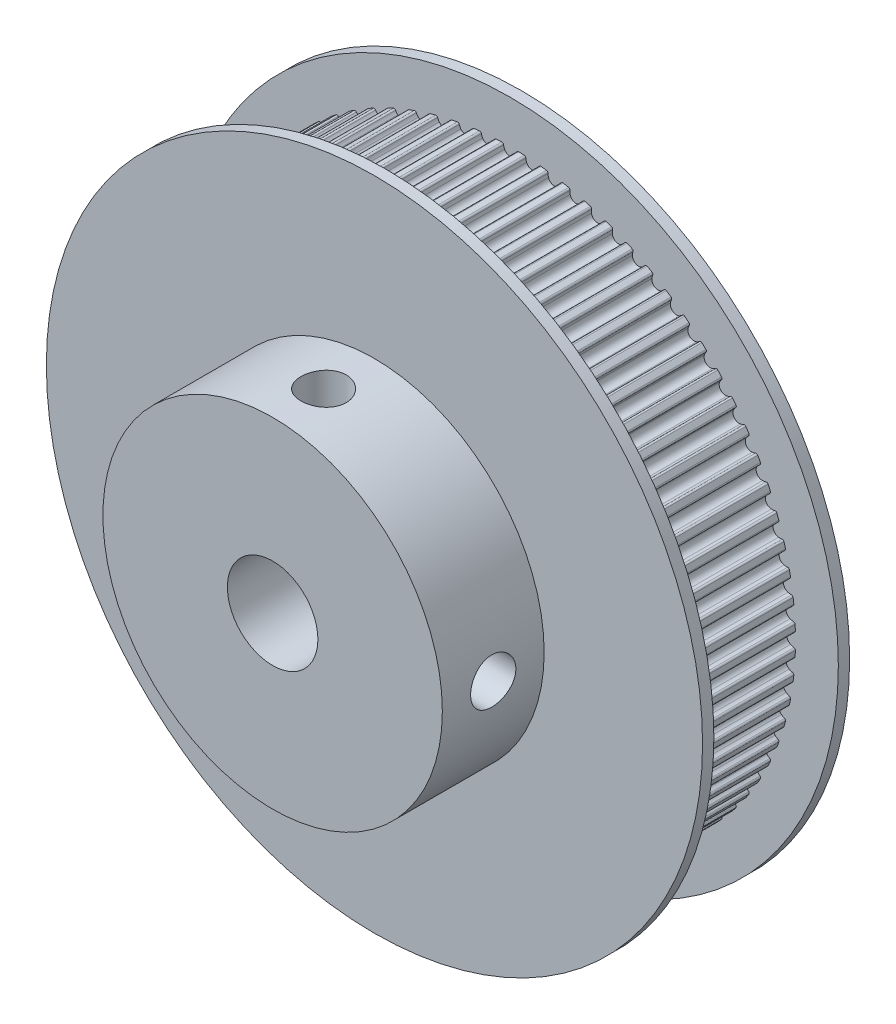
from build123d import *

# Parameters (mm, degrees)
SKETCH1_R           = 25.210790895
BOSS_EXTRUDE1_DEPTH = 5.5
CUT_EXTRUDE1_DEPTH  = 38.311766979
CIRPATTERN1_COUNT   = 80
SKETCH3_R           = 15
BOSS_EXTRUDE2_DEPTH = 10
SKETCH4_R           = 29
BOSS_EXTRUDE3_DEPTH = 1
SKETCH5_R           = 4
CUT_EXTRUDE2_DEPTH  = 47.540305113
SKETCH6_R           = 2
CUT_EXTRUDE3_DEPTH  = 44.843471578
CIRPATTERN2_COUNT   = 2
CIRPATTERN2_ANGLE   = 90


with BuildPart() as part:
    # Sketch1 → Boss-Extrude1 (new, symmetric)
    with BuildSketch(Plane.XY):
        Circle(SKETCH1_R)
    extrude(amount=BOSS_EXTRUDE1_DEPTH, both=True)

    # Sketch2 → Cut-Extrude1 (cut, through all)
    with BuildSketch(Plane.XY.offset(5.5)):
        with BuildLine():
            ThreePointArc((0, 25.210790895), (-0.37159601, 25.208052165), (-0.743111285, 25.19983657))
            ThreePointArc((-0.743111285, 25.19983657), (-0.642002641, 25.164582061), (-0.590165128, 25.070887287))
            ThreePointArc((-0.590165128, 25.070887287), (-0.556224345, 24.918156306), (-0.498876404, 24.772588648))
            ThreePointArc((-0.498876404, 24.772588648), (0, 24.460790895), (0.498876404, 24.772588648))
            ThreePointArc((0.498876404, 24.772588648), (0.556224345, 24.918156306), (0.590165128, 25.070887287))
            ThreePointArc((0.590165128, 25.070887287), (0.642002641, 25.164582061), (0.743111285, 25.19983657))
            ThreePointArc((0.743111285, 25.19983657), (0.37159601, 25.208052165), (0, 25.210790895))
        make_face()
    cut_extrude1 = extrude(amount=-CUT_EXTRUDE1_DEPTH, mode=Mode.SUBTRACT)

    # CirPattern1: Cut-Extrude1 ×80 about axis
    cirpattern1_axis = Axis((0, 0, 5.5), (0, 0, -1))
    for i in range(1, CIRPATTERN1_COUNT):
        add(cut_extrude1.rotate(cirpattern1_axis, i * 360 / CIRPATTERN1_COUNT), mode=Mode.SUBTRACT)

    # Sketch3 → Boss-Extrude2 (add)
    with BuildSketch(Plane.XY.offset(5.5)):
        Circle(SKETCH3_R)
    extrude(amount=BOSS_EXTRUDE2_DEPTH)

    # Sketch4 → Boss-Extrude3 (add)
    with BuildSketch(Plane.XY.offset(5.5)):
        Circle(SKETCH4_R)
    boss_extrude3 = extrude(amount=BOSS_EXTRUDE3_DEPTH)

    # Mirror1: Boss-Extrude3 across plane
    add(boss_extrude3.mirror(Plane.XY))

    # Sketch5 → Cut-Extrude2 (cut, through all)
    with BuildSketch(Plane.XY.offset(15.5)):
        Circle(SKETCH5_R)
    extrude(amount=-CUT_EXTRUDE2_DEPTH, mode=Mode.SUBTRACT)

    # Sketch6 → Cut-Extrude3 (cut, through all)
    with BuildSketch(Plane(origin=(0, 0, 0), x_dir=(0, 0, -1), z_dir=(1, 0, 0))):
        with Locations((-11, 0)):
            Circle(SKETCH6_R)
    cut_extrude3 = extrude(amount=CUT_EXTRUDE3_DEPTH, mode=Mode.SUBTRACT)

    # CirPattern2: Cut-Extrude3 ×2 about axis
    cirpattern2_axis = Axis((0, 0, 15.5), (0, 0, 1))
    for i in range(1, CIRPATTERN2_COUNT):
        add(cut_extrude3.rotate(cirpattern2_axis, i * CIRPATTERN2_ANGLE / (CIRPATTERN2_COUNT - 1)), mode=Mode.SUBTRACT)


solid = part.part
